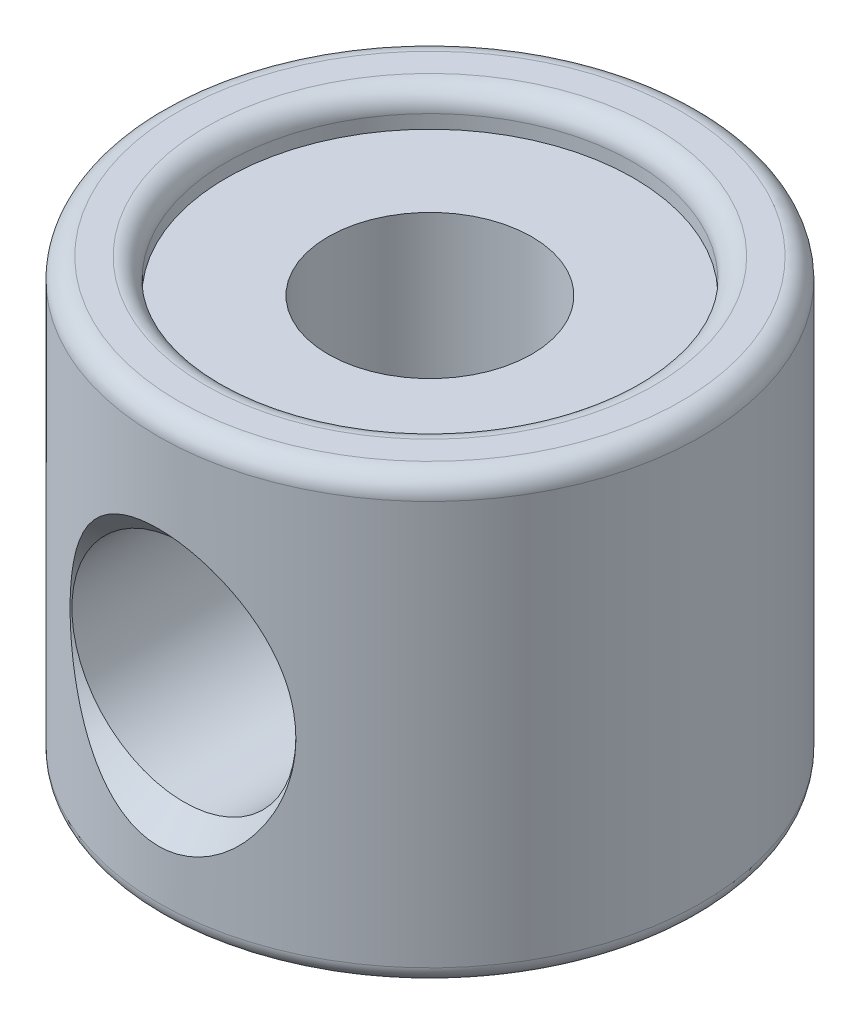
from build123d import *
from OCP.BRepAlgoAPI import BRepAlgoAPI_Cut
from OCP.TopTools import TopTools_ListOfShape

# Parameters (mm, degrees)
SKETCH1_R           = 4
SKETCH1_R_2         = 1.5
BOSS_EXTRUDE1_DEPTH = 6
SKETCH2_R           = 4
SKETCH2_R_2         = 3
BOSS_EXTRUDE2_DEPTH = 0.5
FILLET1_R           = 0.3
FILLET2_R           = 0.25
CIRPATTERN1_START   = -3
CIRPATTERN1_2_DEPTH = 3


with BuildPart() as part:
    # Sketch1 → Boss-Extrude1 (new body)
    with BuildSketch(Plane(origin=(0, 0, 0), x_dir=(1, 0, 0), z_dir=(0, 1, 0))):
        with Locations(Location((0, 0, 0), (0, 0, 270))):
            Circle(SKETCH1_R)
        with Locations(Location((0, 0, 0), (0, 0, 270))):
            Circle(SKETCH1_R_2, mode=Mode.SUBTRACT)
    extrude(amount=BOSS_EXTRUDE1_DEPTH)

    # Sketch2 → Boss-Extrude2 (add)
    with BuildSketch(Plane(origin=(0, 6, 0), x_dir=(1, 0, 0), z_dir=(0, 1, 0))):
        with Locations(Location((0, 0, 0), (0, 0, 270))):
            Circle(SKETCH2_R)
        with Locations(Location((0, 0, 0), (0, 0, 270))):
            Circle(SKETCH2_R_2, mode=Mode.SUBTRACT)
    extrude(amount=BOSS_EXTRUDE2_DEPTH)

    # Fillet1
    fillet1_edges = [part.edges().sort_by_distance(p)[0] for p in [
        (0, 6.5, -4),
        (0, 6.5, -3),
    ]]
    fillet(fillet1_edges, radius=FILLET1_R)

    # Fillet2
    fillet2_edges = [part.edges().sort_by_distance(p)[0] for p in [
        (0, 0, -4),
    ]]
    fillet(fillet2_edges, radius=FILLET2_R)


with BuildPart() as m4_tapped_hole1_tool:
    # M4 Tapped Hole1: read off the stored shape, not the designer's step
    # M4 Tapped Hole1 outline → M4 Tapped Hole1 (revolve)
    with BuildSketch(Plane.XZ.offset(-3)):
        Polygon((2.024995394, 3.999995394), (0, 3.999995394), (0, 0), (1.65, 0), (1.65, 3.625), align=None)
    revolve(axis=Axis((0, 3, 0), (0, 0, 1)))


with BuildPart() as part_1:
    add(part.part)

    # M4 Tapped Hole1: cut by m4_tapped_hole1_tool, with a tolerance
    m4_tapped_hole1_stock = TopTools_ListOfShape()
    m4_tapped_hole1_stock.Append(part_1.part.wrapped)
    m4_tapped_hole1_tools = TopTools_ListOfShape()
    m4_tapped_hole1_tools.Append(m4_tapped_hole1_tool.part.wrapped)
    m4_tapped_hole1_cut = BRepAlgoAPI_Cut()
    m4_tapped_hole1_cut.SetArguments(m4_tapped_hole1_stock)
    m4_tapped_hole1_cut.SetTools(m4_tapped_hole1_tools)
    m4_tapped_hole1_cut.SetFuzzyValue(0.00001)
    m4_tapped_hole1_cut.Build()
    add(Compound.cast(m4_tapped_hole1_cut.Shape()).solids(), mode=Mode.REPLACE)

    # CirPattern1: read off the stored shape, not the designer's step
    # CirPattern1 outline → CirPattern1 (revolve, cut)
    with BuildSketch(Plane(origin=(0, 3, 0), x_dir=(0, 1, 0), z_dir=(0, 0, -1))):
        Polygon((0, -4.000116403), (2.025116403, -4.000116403), (1.65, -3.625), (1.65, -1.575), (0, -1.575), align=None)
    revolve(axis=Axis((0, 3, 0), (1, 0, 0)), mode=Mode.SUBTRACT)

    # CirPattern1 2 outline → CirPattern1 2 (add)
    with BuildSketch(Plane.XY.offset(CIRPATTERN1_START)):
        with BuildLine():
            Line((-1.575, 2.508192111), (-1.575, 3.491807889))
            ThreePointArc((-1.575, 3.491807889), (-1.65, 3), (-1.575, 2.508192111))
        make_face()
    extrude(amount=CIRPATTERN1_2_DEPTH)


solid = part_1.part
